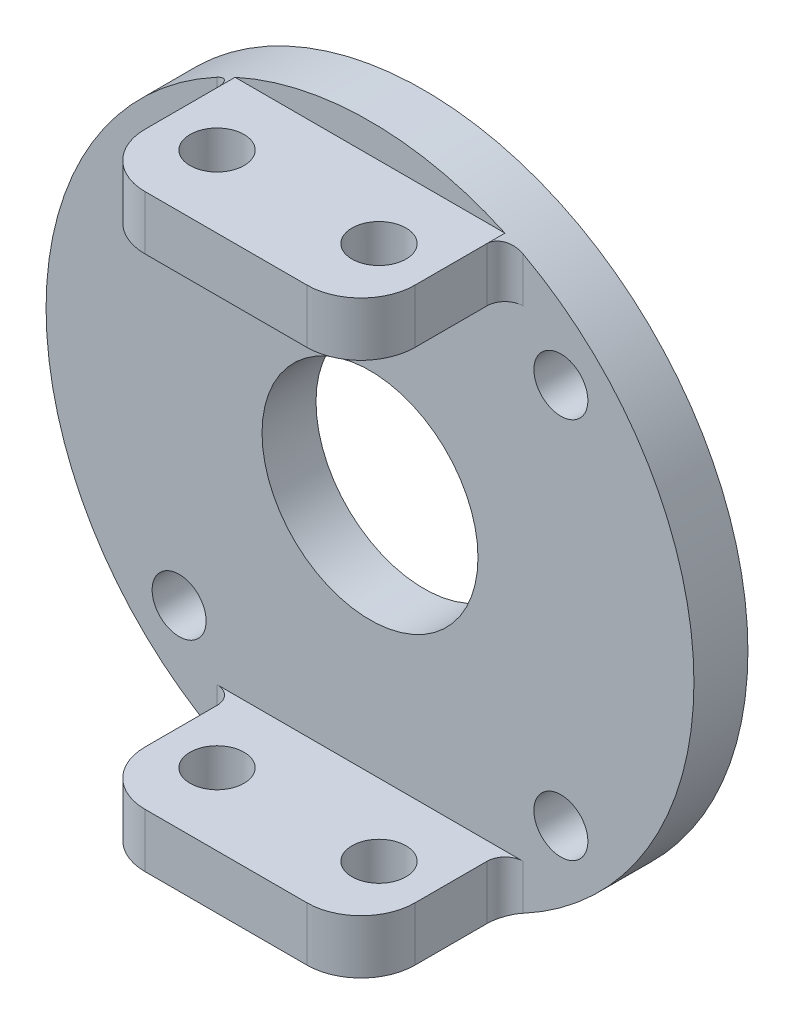
from build123d import *

# Parameters (mm, degrees)
SKETCH_1_R          = 18
EXTRUDE_1_DEPTH     = 3
SKETCH_2_R          = 1.5
CUT_EXTRUDE_1_DEPTH = 3
SKETCH_4_W          = 15
SKETCH_4_H          = 3
EXTRUDE_2_DEPTH     = 8
SKETCH_5_R          = 1.5
CUT_EXTRUDE_2_DEPTH = 37
FILLET_1_R          = 3
FILLET_2_R          = 1
SKETCH_6_R          = 6
CUT_EXTRUDE_3_DEPTH = 37


with BuildPart() as part:
    # Эскиз1 → Бобышка-Вытянуть1 (new body)
    with BuildSketch(Plane.XY):
        Circle(SKETCH_1_R)
    extrude(amount=EXTRUDE_1_DEPTH)

    # Эскиз2 → Вырез-Вытянуть1 (cut)
    with BuildSketch(Plane.XY.offset(3)):
        with Locations((-10.606601718, -10.606601718)):
            Circle(SKETCH_2_R)
        with Locations((10.606601718, -10.606601718)):
            Circle(SKETCH_2_R)
        with Locations((10.606601718, 10.606601718)):
            Circle(SKETCH_2_R)
        with Locations((-10.606601718, 10.606601718)):
            Circle(SKETCH_2_R)
    extrude(amount=-CUT_EXTRUDE_1_DEPTH, mode=Mode.SUBTRACT)

    # Эскиз4 → Бобышка-Вытянуть2 (add)
    with BuildSketch(Plane.XY.offset(3)):
        with Locations((0, 14.863068172)):
            Rectangle(SKETCH_4_W, SKETCH_4_H)
        with Locations((0, -14.863068172)):
            Rectangle(SKETCH_4_W, SKETCH_4_H)
    extrude(amount=EXTRUDE_2_DEPTH)

    # Эскиз5 → Вырез-Вытянуть2 (cut)
    with BuildSketch(Plane(origin=(0, 16.363068172, 0), x_dir=(1, 0, 0), z_dir=(0, 1, 0))):
        with Locations(Location((-4.5, -7, 0), (0, 0, 270))):
            Circle(SKETCH_5_R)
        with Locations(Location((4.5, -7, 0), (0, 0, 270))):
            Circle(SKETCH_5_R)
    extrude(amount=-CUT_EXTRUDE_2_DEPTH, mode=Mode.SUBTRACT)

    # Скругление1
    fillet_1_edges = [part.edges().sort_by_distance(p)[0] for p in [
        (-7.5, 14.863068172, 11),
        (7.5, 14.863068172, 11),
        (7.5, -14.863068172, 11),
        (-7.5, -14.863068172, 11),
    ]]
    fillet(fillet_1_edges, radius=FILLET_1_R)

    # Скругление2
    # the kernel refuses this fillet: 1 mm, written as the material it adds along each edge
    with BuildSketch(Plane(origin=(-7.5, 16.363068172, 3), x_dir=(-1, 0, 0), z_dir=(0, -1, 0))) as fillet_2_piece_1_section:
        with BuildLine():
            CenterArc((FILLET_2_R, -FILLET_2_R), FILLET_2_R, 90, 90)
            Line((0, -FILLET_2_R), (0, 0))
            Line((0, 0), (FILLET_2_R, 0))
        make_face()
    fillet_2_piece_1 = extrude(amount=3, mode=Mode.PRIVATE)
    fillet_2_piece_1 = fillet_2_piece_1 & Plane(origin=(0, 0, 3.230923565), x_dir=(1, 0, 0), z_dir=(0, 0, -1)) * Cylinder(18, 11, mode=Mode.PRIVATE)
    add(fillet_2_piece_1)
    with BuildSketch(Plane(origin=(7.5, 13.363068172, 3), x_dir=(1, 0, 0), z_dir=(0, 1, 0))) as fillet_2_piece_2_section:
        with BuildLine():
            CenterArc((FILLET_2_R, -FILLET_2_R), FILLET_2_R, 90, 90)
            Line((0, -FILLET_2_R), (0, 0))
            Line((0, 0), (FILLET_2_R, 0))
        make_face()
    fillet_2_piece_2 = extrude(amount=3, mode=Mode.PRIVATE)
    fillet_2_piece_2 = fillet_2_piece_2 & Plane(origin=(0, 0, 3.230923565), x_dir=(1, 0, 0), z_dir=(0, 0, -1)) * Cylinder(18, 10, mode=Mode.PRIVATE)
    add(fillet_2_piece_2)
    with BuildSketch(Plane(origin=(7.5, -16.363068172, 3), x_dir=(0, 0, 1), z_dir=(0, 1, 0))) as fillet_2_piece_3_section:
        with BuildLine():
            CenterArc((FILLET_2_R, FILLET_2_R), FILLET_2_R, 180, 90)
            Line((0, FILLET_2_R), (0, 0))
            Line((0, 0), (FILLET_2_R, 0))
        make_face()
    fillet_2_piece_3 = extrude(amount=3, mode=Mode.PRIVATE)
    fillet_2_piece_3 = fillet_2_piece_3 & Plane(origin=(0, 0, 3.230923542), x_dir=(1, 0, 0), z_dir=(0, 0, -1)) * Cylinder(18, 10, mode=Mode.PRIVATE)
    add(fillet_2_piece_3)
    with BuildSketch(Plane(origin=(-7.5, -13.363068172, 3), x_dir=(-1, 0, 0), z_dir=(0, -1, 0))) as fillet_2_piece_4_section:
        with BuildLine():
            CenterArc((FILLET_2_R, -FILLET_2_R), FILLET_2_R, 90, 90)
            Line((0, -FILLET_2_R), (0, 0))
            Line((0, 0), (FILLET_2_R, 0))
        make_face()
    fillet_2_piece_4 = extrude(amount=3, mode=Mode.PRIVATE)
    fillet_2_piece_4 = fillet_2_piece_4 & Plane(origin=(0, 0, 3.230923565), x_dir=(1, 0, 0), z_dir=(0, 0, -1)) * Cylinder(18, 11, mode=Mode.PRIVATE)
    add(fillet_2_piece_4)

    # Эскиз6 → Вырез-Вытянуть3 (cut)
    with BuildSketch(Plane.XY.offset(3)):
        Circle(SKETCH_6_R)
    extrude(amount=-CUT_EXTRUDE_3_DEPTH, mode=Mode.SUBTRACT)


solid = part.part
